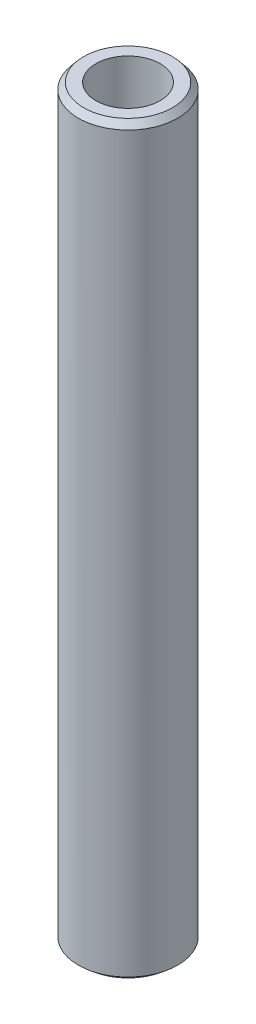
from build123d import *
from OCP.BRepFilletAPI import BRepFilletAPI_MakeChamfer

# Parameters (mm, degrees)
SKETCH1_R           = 40
BOSS_EXTRUDE1_DEPTH = 600
SKETCH2_R           = 25.874364438
CUT_EXTRUDE1_DEPTH  = 603.660766933
CHAMFER1_SIZE       = 5.130616191
CHAMFER1_SIZE2      = 4.287699929


with BuildPart() as part:
    # Sketch1 → Boss-Extrude1 (new body)
    with BuildSketch(Plane(origin=(0, 0, 0), x_dir=(1, 0, 0), z_dir=(0, 1, 0))):
        Circle(SKETCH1_R)
    extrude(amount=BOSS_EXTRUDE1_DEPTH)

    # Sketch2 → Cut-Extrude1 (cut, through all)
    with BuildSketch(Plane(origin=(0, 0, 0), x_dir=(1, 0, 0), z_dir=(0, 1, 0))):
        Circle(SKETCH2_R)
    extrude(amount=CUT_EXTRUDE1_DEPTH, mode=Mode.SUBTRACT)

    # Chamfer1: one chamfer whose edges measure the first distance from different faces: ONE call of the kernel's chamfer builder (chamfer() names one face for all edges)
    chamfer1_edges_1 = [part.edges().sort_by_distance(p)[0] for p in [
        (-40, 600, 0),
    ]]
    chamfer1_side_1 = [part.faces().sort_by_distance(p)[0] for p in [
        (-40, 300, 0),
    ]]
    chamfer1_edges_2 = [part.edges().sort_by_distance(p)[0] for p in [
        (-40, 0, 0),
    ]]
    chamfer1_side_2 = [part.faces().sort_by_distance(p)[0] for p in [
        (-38.86862915, 0, 0),
    ]]
    chamfer1 = BRepFilletAPI_MakeChamfer(part.part.solid().wrapped)
    for e in chamfer1_edges_1:
        chamfer1.Add(CHAMFER1_SIZE, CHAMFER1_SIZE2, e.wrapped, chamfer1_side_1[0].wrapped)  # the first distance lies on this face
    for e in chamfer1_edges_2:
        chamfer1.Add(CHAMFER1_SIZE, CHAMFER1_SIZE2, e.wrapped, chamfer1_side_2[0].wrapped)  # the first distance lies on this face
    add(Compound.cast(chamfer1.Shape()), mode=Mode.REPLACE)


solid = part.part
